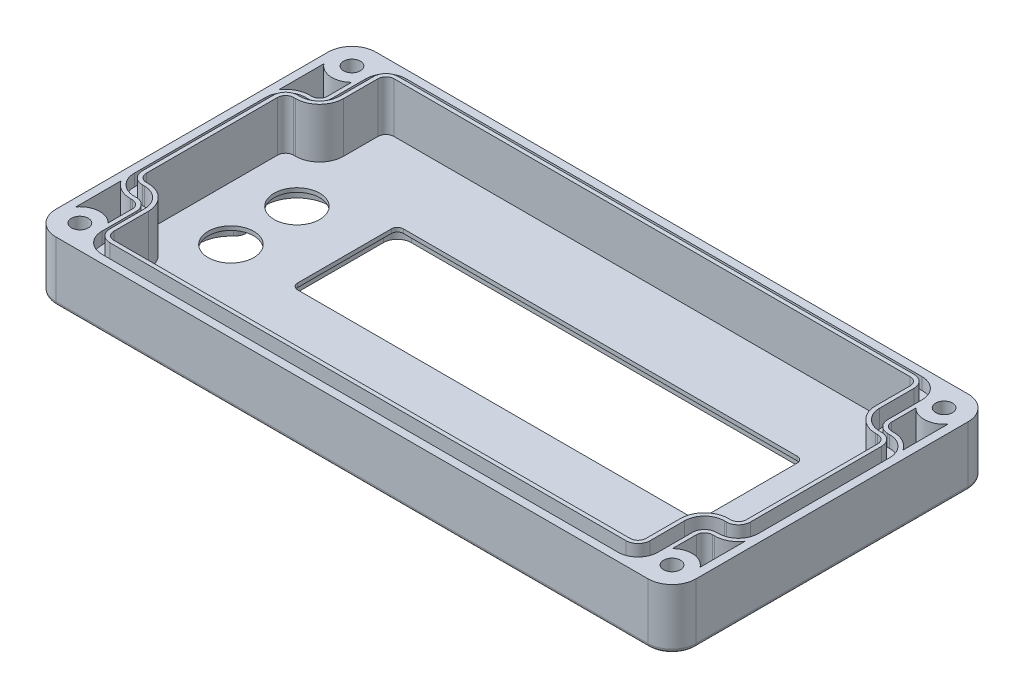
from build123d import *

# Parameters (mm, degrees)
EXTRUDE_1_DEPTH       = 15
CUT_EXTRUDE_START     = 4
CUT_EXTRUDE_1_DEPTH   = 11
CUT_EXTRUDE_START_2   = 2.5
CUT_EXTRUDE_2_DEPTH   = 12.5
MIRROR_START          = 2.5
MIRROR_2_COPY_1_DEPTH = 12.5
EXTRUDE_START         = 15
EXTRUDE_1_2_DEPTH     = 1.5
SKETCH_6_R            = 3.75
CUT_EXTRUDE_3_DEPTH   = 3
SKETCH_7_R            = 2.1
CUT_EXTRUDE_4_DEPTH   = 15
CUT_EXTRUDE_START_3   = 12
CUT_EXTRUDE_2_2_DEPTH = 3
FILLET_1_R            = 1
SKETCH_11_R           = 5.7
SKETCH_11_W           = 101.424569505
SKETCH_11_H           = 26.433268975
CUT_EXTRUDE_5_DEPTH   = 106
FILLET_2_R            = 1.5
SKETCH_12_R           = 8.2
CUT_EXTRUDE_6_DEPTH   = 3
SKETCH_13_W           = 9
SKETCH_13_H           = 16.50000002
SKETCH_13_W_2         = 16.50000002
SKETCH_13_H_2         = 9
CUT_EXTRUDE_8_DEPTH   = 3
FILLET_3_R            = 3


with BuildPart() as part:
    # Эскиз1 → Extrude 1 (new body)
    with BuildSketch(Plane(origin=(0, 0, 0), x_dir=(1, 0, 0), z_dir=(0, 1, 0))):
        with BuildLine():
            Line((-74, 40), (74, 40))
            ThreePointArc((74, 40), (78.242640687, 38.242640687), (80, 34))
            Line((80, 34), (80, -34))
            ThreePointArc((80, -34), (78.242640687, -38.242640687), (74, -40))
            Line((74, -40), (-74, -40))
            ThreePointArc((-74, -40), (-78.242640687, -38.242640687), (-80, -34))
            Line((-80, -34), (-80, 34))
            ThreePointArc((-80, 34), (-78.242640687, 38.242640687), (-74, 40))
        make_face()
    extrude(amount=EXTRUDE_1_DEPTH)

    # Эскиз2 → Вырез-Вытянуть1 (cut)
    with BuildSketch(Plane(origin=(0, 0, 0), x_dir=(1, 0, 0), z_dir=(0, 1, 0)).offset(CUT_EXTRUDE_START)):
        with BuildLine():
            Line((-66.5, 33), (-66.5, 24.4))
            ThreePointArc((-66.5, 24.4), (-68.257359313, 20.157359313), (-72.5, 18.4))
            Line((-72.5, 18.4), (-73, 18.4))
            ThreePointArc((-73, 18.4), (-74.414213562, 17.814213562), (-75, 16.4))
            Line((-75, 16.4), (-75, -16.4))
            ThreePointArc((-75, -16.4), (-74.414213562, -17.814213562), (-73, -18.4))
            Line((-73, -18.4), (-72.5, -18.4))
            ThreePointArc((-72.5, -18.4), (-68.257359313, -20.157359313), (-66.5, -24.4))
            Line((-66.5, -24.4), (-66.5, -33))
            ThreePointArc((-66.5, -33), (-65.914213562, -34.414213562), (-64.5, -35))
            Line((-64.5, -35), (64.5, -35))
            ThreePointArc((64.5, -35), (65.914213562, -34.414213562), (66.5, -33))
            Line((66.5, -33), (66.5, -24.4))
            ThreePointArc((66.5, -24.4), (68.257359313, -20.157359313), (72.5, -18.4))
            Line((72.5, -18.4), (73, -18.4))
            ThreePointArc((73, -18.4), (74.414213562, -17.814213562), (75, -16.4))
            Line((75, -16.4), (75, 16.4))
            ThreePointArc((75, 16.4), (74.414213562, 17.814213562), (73, 18.4))
            Line((73, 18.4), (72.5, 18.4))
            ThreePointArc((72.5, 18.4), (68.257359313, 20.157359313), (66.5, 24.4))
            Line((66.5, 24.4), (66.5, 33))
            ThreePointArc((66.5, 33), (65.914213562, 34.414213562), (64.5, 35))
            Line((64.5, 35), (-64.5, 35))
            ThreePointArc((-64.5, 35), (-65.914213562, 34.414213562), (-66.5, 33))
        make_face()
    extrude(amount=CUT_EXTRUDE_1_DEPTH, mode=Mode.SUBTRACT)

    # Эскиз3 → Cut-Extrude 2 (cut)
    with BuildSketch(Plane(origin=(0, 0, 0), x_dir=(1, 0, 0), z_dir=(0, 1, 0)).offset(CUT_EXTRUDE_START_2)):
        with BuildLine():
            ThreePointArc((-70.5, 30.429285786), (-74.379379333, 29.014413643), (-78, 31))
            Line((-78, 31), (-78, 19.71662479))
            ThreePointArc((-78, 19.71662479), (-75.837274331, 21.686764074), (-73, 22.4))
            Line((-73, 22.4), (-72.5, 22.4))
            ThreePointArc((-72.5, 22.4), (-71.085786438, 22.985786438), (-70.5, 24.4))
            Line((-70.5, 24.4), (-70.5, 30.429285786))
        make_face()
    cut_extrude_2 = extrude(amount=CUT_EXTRUDE_2_DEPTH, mode=Mode.SUBTRACT)

    # Зеркальное отражение1: Cut-Extrude 2 across plane
    add(cut_extrude_2.mirror(Plane.XY), mode=Mode.SUBTRACT)

    # Зеркальное отражение2: Cut-Extrude 2 across plane
    add(cut_extrude_2.mirror(Plane(origin=(0, 0, 0), x_dir=(0, 0, 1), z_dir=(1, 0, 0))), mode=Mode.SUBTRACT)

    # Зеркальное отражение2 copy 1 sketch → Зеркальное отражение2 copy 1 (cut)
    with BuildSketch(Plane(origin=(0, 0, 0), x_dir=(-1, 0, 0), z_dir=(0, 1, 0)).offset(MIRROR_START)):
        with BuildLine():
            ThreePointArc((-70.5, 30.429285786), (-74.379379333, 29.014413643), (-78, 31))
            Line((-78, 31), (-78, 19.71662479))
            ThreePointArc((-78, 19.71662479), (-75.837274331, 21.686764074), (-73, 22.4))
            Line((-73, 22.4), (-72.5, 22.4))
            ThreePointArc((-72.5, 22.4), (-71.085786438, 22.985786438), (-70.5, 24.4))
            Line((-70.5, 24.4), (-70.5, 30.429285786))
        make_face()
    extrude(amount=MIRROR_2_COPY_1_DEPTH, mode=Mode.SUBTRACT)

    # Эскиз2<2> → Extrude 1 2 (add)
    with BuildSketch(Plane(origin=(0, 0, 0), x_dir=(1, 0, 0), z_dir=(0, 1, 0)).offset(EXTRUDE_START)):
        with BuildLine():
            Line((-67.5, 33), (-67.5, 24.4))
            ThreePointArc((-67.5, 24.4), (-68.964466094, 20.864466094), (-72.5, 19.4))
            Line((-72.5, 19.4), (-73, 19.4))
            ThreePointArc((-73, 19.4), (-75.121320344, 18.521320344), (-76, 16.4))
            Line((-76, 16.4), (-76, -16.4))
            ThreePointArc((-76, -16.4), (-75.121320344, -18.521320344), (-73, -19.4))
            Line((-73, -19.4), (-72.5, -19.4))
            ThreePointArc((-72.5, -19.4), (-68.964466094, -20.864466094), (-67.5, -24.4))
            Line((-67.5, -24.4), (-67.5, -33))
            ThreePointArc((-67.5, -33), (-66.621320344, -35.121320344), (-64.5, -36))
            Line((-64.5, -36), (64.5, -36))
            ThreePointArc((64.5, -36), (66.621320344, -35.121320344), (67.5, -33))
            Line((67.5, -33), (67.5, -24.4))
            ThreePointArc((67.5, -24.4), (68.964466094, -20.864466094), (72.5, -19.4))
            Line((72.5, -19.4), (73, -19.4))
            ThreePointArc((73, -19.4), (75.121320344, -18.521320344), (76, -16.4))
            Line((76, -16.4), (76, 16.4))
            ThreePointArc((76, 16.4), (75.121320344, 18.521320344), (73, 19.4))
            Line((73, 19.4), (72.5, 19.4))
            ThreePointArc((72.5, 19.4), (68.964466094, 20.864466094), (67.5, 24.4))
            Line((67.5, 24.4), (67.5, 33))
            ThreePointArc((67.5, 33), (66.621320344, 35.121320344), (64.5, 36))
            Line((64.5, 36), (-64.5, 36))
            ThreePointArc((-64.5, 36), (-66.621320344, 35.121320344), (-67.5, 33))
        make_face()
        with BuildLine():
            Line((-66.5, 33), (-66.5, 24.4))
            ThreePointArc((-66.5, 24.4), (-68.257359313, 20.157359313), (-72.5, 18.4))
            Line((-72.5, 18.4), (-73, 18.4))
            ThreePointArc((-73, 18.4), (-74.414213562, 17.814213562), (-75, 16.4))
            Line((-75, 16.4), (-75, -16.4))
            ThreePointArc((-75, -16.4), (-74.414213562, -17.814213562), (-73, -18.4))
            Line((-73, -18.4), (-72.5, -18.4))
            ThreePointArc((-72.5, -18.4), (-68.257359313, -20.157359313), (-66.5, -24.4))
            Line((-66.5, -24.4), (-66.5, -33))
            ThreePointArc((-66.5, -33), (-65.914213562, -34.414213562), (-64.5, -35))
            Line((-64.5, -35), (64.5, -35))
            ThreePointArc((64.5, -35), (65.914213562, -34.414213562), (66.5, -33))
            Line((66.5, -33), (66.5, -24.4))
            ThreePointArc((66.5, -24.4), (68.257359313, -20.157359313), (72.5, -18.4))
            Line((72.5, -18.4), (73, -18.4))
            ThreePointArc((73, -18.4), (74.414213562, -17.814213562), (75, -16.4))
            Line((75, -16.4), (75, 16.4))
            ThreePointArc((75, 16.4), (74.414213562, 17.814213562), (73, 18.4))
            Line((73, 18.4), (72.5, 18.4))
            ThreePointArc((72.5, 18.4), (68.257359313, 20.157359313), (66.5, 24.4))
            Line((66.5, 24.4), (66.5, 33))
            ThreePointArc((66.5, 33), (65.914213562, 34.414213562), (64.5, 35))
            Line((64.5, 35), (-64.5, 35))
            ThreePointArc((-64.5, 35), (-65.914213562, 34.414213562), (-66.5, 33))
        make_face(mode=Mode.SUBTRACT)
    extrude(amount=EXTRUDE_1_2_DEPTH)

    # Эскиз6 → Вырез-Вытянуть3 (cut)
    with BuildSketch(Plane(origin=(0, 0, 0), x_dir=(1, 0, 0), z_dir=(0, 1, 0))):
        with Locations(Location((-74, 34, 0), (0, 0, 270))):
            Circle(SKETCH_6_R)
        with Locations(Location((-74, -34, 0), (0, 0, 270))):
            Circle(SKETCH_6_R)
        with Locations(Location((74, -34, 0), (0, 0, 270))):
            Circle(SKETCH_6_R)
        with Locations(Location((74, 34, 0), (0, 0, 270))):
            Circle(SKETCH_6_R)
    extrude(amount=CUT_EXTRUDE_3_DEPTH, mode=Mode.SUBTRACT)

    # Эскиз7 → Вырез-Вытянуть4 (cut)
    with BuildSketch(Plane(origin=(0, 0, 0), x_dir=(1, 0, 0), z_dir=(0, 1, 0))):
        with Locations(Location((-74, 34, 0), (0, 0, 90))):
            Circle(SKETCH_7_R)
        with Locations(Location((-74, -34, 0), (0, 0, 90))):
            Circle(SKETCH_7_R)
        with Locations(Location((74, -34, 0), (0, 0, 90))):
            Circle(SKETCH_7_R)
        with Locations(Location((74, 34, 0), (0, 0, 90))):
            Circle(SKETCH_7_R)
    extrude(amount=CUT_EXTRUDE_4_DEPTH, mode=Mode.SUBTRACT)

    # Эскиз10 → Cut-Extrude 2 2 (cut)
    with BuildSketch(Plane(origin=(0, 0, 0), x_dir=(1, 0, 0), z_dir=(0, 1, 0)).offset(CUT_EXTRUDE_START_3)):
        with BuildLine():
            Line((69.5, 24.4), (69.5, 33))
            ThreePointArc((69.5, 33), (68.035533906, 36.535533906), (64.5, 38))
            Line((64.5, 38), (-64.5, 38))
            ThreePointArc((-64.5, 38), (-68.035533906, 36.535533906), (-69.5, 33))
            Line((-69.5, 33), (-69.5, 24.4))
            ThreePointArc((-69.5, 24.4), (-70.378679656, 22.278679656), (-72.5, 21.4))
            Line((-72.5, 21.4), (-73, 21.4))
            ThreePointArc((-73, 21.4), (-76.535533906, 19.935533906), (-78, 16.4))
            Line((-78, 16.4), (-78, -16.4))
            ThreePointArc((-78, -16.4), (-76.535533906, -19.935533906), (-73, -21.4))
            Line((-73, -21.4), (-72.5, -21.4))
            ThreePointArc((-72.5, -21.4), (-70.378679656, -22.278679656), (-69.5, -24.4))
            Line((-69.5, -24.4), (-69.5, -33))
            ThreePointArc((-69.5, -33), (-68.035533906, -36.535533906), (-64.5, -38))
            Line((-64.5, -38), (64.5, -38))
            ThreePointArc((64.5, -38), (68.035533906, -36.535533906), (69.5, -33))
            Line((69.5, -33), (69.5, -24.4))
            ThreePointArc((69.5, -24.4), (70.378679656, -22.278679656), (72.5, -21.4))
            Line((72.5, -21.4), (73, -21.4))
            ThreePointArc((73, -21.4), (76.535533906, -19.935533906), (78, -16.4))
            Line((78, -16.4), (78, 16.4))
            ThreePointArc((78, 16.4), (76.535533906, 19.935533906), (73, 21.4))
            Line((73, 21.4), (72.5, 21.4))
            ThreePointArc((72.5, 21.4), (70.378679656, 22.278679656), (69.5, 24.4))
        make_face()
        with BuildLine():
            Line((67.5, 24.4), (67.5, 33))
            ThreePointArc((67.5, 33), (66.621320344, 35.121320344), (64.5, 36))
            Line((64.5, 36), (-64.5, 36))
            ThreePointArc((-64.5, 36), (-66.621320344, 35.121320344), (-67.5, 33))
            Line((-67.5, 33), (-67.5, 24.4))
            ThreePointArc((-67.5, 24.4), (-68.964466094, 20.864466094), (-72.5, 19.4))
            Line((-72.5, 19.4), (-73, 19.4))
            ThreePointArc((-73, 19.4), (-75.121320344, 18.521320344), (-76, 16.4))
            Line((-76, 16.4), (-76, -16.4))
            ThreePointArc((-76, -16.4), (-75.121320344, -18.521320344), (-73, -19.4))
            Line((-73, -19.4), (-72.5, -19.4))
            ThreePointArc((-72.5, -19.4), (-68.964466094, -20.864466094), (-67.5, -24.4))
            Line((-67.5, -24.4), (-67.5, -33))
            ThreePointArc((-67.5, -33), (-66.621320344, -35.121320344), (-64.5, -36))
            Line((-64.5, -36), (64.5, -36))
            ThreePointArc((64.5, -36), (66.621320344, -35.121320344), (67.5, -33))
            Line((67.5, -33), (67.5, -24.4))
            ThreePointArc((67.5, -24.4), (68.964466094, -20.864466094), (72.5, -19.4))
            Line((72.5, -19.4), (73, -19.4))
            ThreePointArc((73, -19.4), (75.121320344, -18.521320344), (76, -16.4))
            Line((76, -16.4), (76, 16.4))
            ThreePointArc((76, 16.4), (75.121320344, 18.521320344), (73, 19.4))
            Line((73, 19.4), (72.5, 19.4))
            ThreePointArc((72.5, 19.4), (68.964466094, 20.864466094), (67.5, 24.4))
        make_face(mode=Mode.SUBTRACT)
    extrude(amount=CUT_EXTRUDE_2_2_DEPTH, mode=Mode.SUBTRACT)

    # Скругление1
    fillet_1_edges = [part.edges().sort_by_distance(p)[0] for p in [
        (0, 0, -40),
        (78.242640687, 0, -38.242640687),
        (80, 0, 0),
        (78.242640687, 0, 38.242640687),
        (0, 0, 40),
        (-78.242640687, 0, 38.242640687),
        (-80, 0, 0),
        (-78.242640687, 0, -38.242640687),
    ]]
    fillet(fillet_1_edges, radius=FILLET_1_R)

    # Эскиз11 → Вырез-Вытянуть5 (cut, through all)
    with BuildSketch(Plane(origin=(0, 55, 0), x_dir=(-1, 0, 0), z_dir=(0, -1, 0))):
        with Locations(Location((61.500223126, 7.750033106, 0), (0, 0, 270))):
            Circle(SKETCH_11_R)
        with Locations(Location((61.500221489, -8.749966914, 0), (0, 0, 270))):
            Circle(SKETCH_11_R)
        with Locations(Location((38.249950995, -29.249773748, 0), (0, 0, 270))):
            Circle(SKETCH_11_R)
        with Locations(Location((21.749950975, -29.249772111, 0), (0, 0, 270))):
            Circle(SKETCH_11_R)
        with Locations((-5.885281062, 2.962057494)):
            Rectangle(SKETCH_11_W, SKETCH_11_H)
    extrude(amount=CUT_EXTRUDE_5_DEPTH, mode=Mode.SUBTRACT)

    # Скругление2
    fillet_2_edges = [part.edges().sort_by_distance(p)[0] for p in [
        (-44.827003691, 2, 10.254576993),
        (-44.827003691, 2, -16.178691982),
        (56.597565814, 2, -16.178691982),
        (56.597565814, 2, 10.254576993),
    ]]
    fillet(fillet_2_edges, radius=FILLET_2_R)

    # Эскиз12 → Вырез-Вытянуть6 (cut)
    with BuildSketch(Plane.XZ):
        with Locations(Location((-61.500223126, -7.750033106, 0), (0, 0, 270))):
            Circle(SKETCH_12_R)
        with Locations(Location((-61.500221489, 8.749966914, 0), (0, 0, 270))):
            Circle(SKETCH_12_R)
        with Locations(Location((-38.249950995, 29.249773748, 0), (0, 0, 270))):
            Circle(SKETCH_12_R)
        with Locations(Location((-21.749950975, 29.249772111, 0), (0, 0, 270))):
            Circle(SKETCH_12_R)
        with BuildLine():
            Line((-46.827003691, 8.754576993), (-46.827003691, -14.678691982))
            ThreePointArc((-46.827003691, -14.678691982), (-45.801877425, -17.153565716), (-43.327003691, -18.178691982))
            Line((-43.327003691, -18.178691982), (55.097565814, -18.178691982))
            ThreePointArc((55.097565814, -18.178691982), (57.572439548, -17.153565716), (58.597565814, -14.678691982))
            Line((58.597565814, -14.678691982), (58.597565814, 8.754576993))
            ThreePointArc((58.597565814, 8.754576993), (57.572439548, 11.229450728), (55.097565814, 12.254576993))
            Line((55.097565814, 12.254576993), (-43.327003691, 12.254576993))
            ThreePointArc((-43.327003691, 12.254576993), (-45.801877425, 11.229450728), (-46.827003691, 8.754576993))
        make_face()
    extrude(amount=-CUT_EXTRUDE_6_DEPTH, mode=Mode.SUBTRACT)

    # Эскиз13 → Вырез-Вытянуть8 (cut)
    with BuildSketch(Plane.XZ):
        with Locations((-61.500223126, 0.499966904)):
            Rectangle(SKETCH_13_W, SKETCH_13_H)
        with Locations((-29.999950985, 29.249772111)):
            Rectangle(SKETCH_13_W_2, SKETCH_13_H_2)
    extrude(amount=-CUT_EXTRUDE_8_DEPTH, mode=Mode.SUBTRACT)

    # Скругление3
    # the kernel refuses this fillet: 3 mm, written as the material it takes off along each edge
    with BuildSketch(Plane(origin=(-57.000223126, 3, -0.895107869), x_dir=(0.7916348263994183, 0, -0.6109945184955123), z_dir=(0, -1, 0))) as fillet_3_piece_1:
        with BuildLine():
            CenterArc((1.480941646, 2.991246177), FILLET_3_R, 217.661447916, 47.960493671)
            Line((-0.893962834, 1.158262621), (0, 0))
            ThreePointArc((0, 0), (0.625965025, 0.023927117), (1.251930051, 0))
        make_face()
    extrude(amount=6.65781855, mode=Mode.SUBTRACT)
    with BuildSketch(Plane(origin=(-57.000223126, 3, 1.895040603), x_dir=(0, 0, -1), z_dir=(0, -1, 0)), Plane(origin=(-31.395024684, 3, 33.749772111), x_dir=(1, 0, 0), z_dir=(0, -1, 0))) as fillet_3_piece_2:
        with BuildLine():
            CenterArc((1.463127821, 3), FILLET_3_R, 222.039495053, 47.960504947)
            ThreePointArc((-0.764922393, 0.991071867), (-0.363519644, 0.510155275), (0, 0))
            Line((0, 0), (1.463127821, 0))
        make_face()
    extrude(amount=6.657819554, mode=Mode.SUBTRACT)
    with BuildSketch(Plane(origin=(-66.000223126, 3, -0.895107869), x_dir=(0, 0, 1), z_dir=(0, -1, 0)), Plane(origin=(-28.604876212, 3, 24.749772111), x_dir=(-1, 0, 0), z_dir=(0, -1, 0))) as fillet_3_piece_3:
        with BuildLine():
            CenterArc((1.46312742, 3), FILLET_3_R, 222.039506329, 47.960493671)
            ThreePointArc((-0.764922399, 0.991071429), (-0.36351966, 0.510155052), (0, 0))
            Line((0, 0), (1.46312742, 0))
        make_face()
    extrude(amount=6.65781855, mode=Mode.SUBTRACT)
    with BuildSketch(Plane(origin=(-66.000223126, 3, 1.895042752), x_dir=(0, 0, -1), z_dir=(0, -1, 0))) as fillet_3_piece_4:
        with BuildLine():
            CenterArc((1.463127019, -3), FILLET_3_R, 90, 47.960482395)
            ThreePointArc((-0.764922405, -0.99107099), (-0.363519677, -0.510154829), (0, 0))
            Line((0, 0), (1.463127019, 0))
        make_face()
    extrude(amount=6.657817547, mode=Mode.SUBTRACT)
    with BuildSketch(Plane(origin=(-31.395026833, 3, 24.749772111), x_dir=(-0.6109946909141869, 0, -0.7916346933243117), z_dir=(0, -1, 0))) as fillet_3_piece_5:
        with BuildLine():
            CenterArc((1.480941239, 2.991246181), FILLET_3_R, 217.661460395, 47.960482395)
            Line((-0.893962841, 1.158262109), (0, 0))
            ThreePointArc((0, 0), (0.625964854, 0.023927104), (1.251929708, 0))
        make_face()
    extrude(amount=6.657817547, mode=Mode.SUBTRACT)
    with BuildSketch(Plane(origin=(-28.604876212, 3, 33.749772111), x_dir=(-1, 0, 0), z_dir=(0, -1, 0))) as fillet_3_piece_6:
        with BuildLine():
            CenterArc((1.46312742, -3), FILLET_3_R, 90, 47.960493671)
            ThreePointArc((-0.764922399, -0.991071429), (-0.36351966, -0.510155052), (0, 0))
            Line((0, 0), (1.46312742, 0))
        make_face()
    extrude(amount=6.65781855, mode=Mode.SUBTRACT)


solid = part.part
